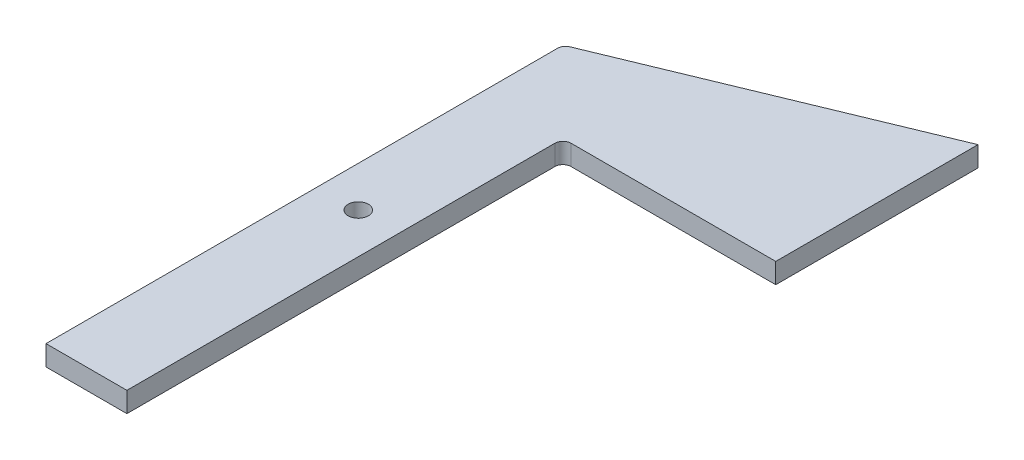
from build123d import *

# Parameters (mm, degrees)
BOSS_EXTRUDE1_DEPTH = 6.35
SKETCH2_R           = 3.175
CUT_EXTRUDE1_DEPTH  = 6.35
FILLET1_R           = 2.54


with BuildPart() as part:
    # Sketch1 → Boss-Extrude1 (new body)
    with BuildSketch(Plane(origin=(0, 0, 0), x_dir=(1, 0, 0), z_dir=(0, 1, 0))):
        Polygon((-50, 128.026), (42.202, 166.126), (42.202, 128.026), (42.202, 102.626), (-24.6, 102.626), (-24.6, -34.28), (-50, -34.28), align=None)
    extrude(amount=BOSS_EXTRUDE1_DEPTH)

    # Sketch2 → Cut-Extrude1 (cut)
    with BuildSketch(Plane(origin=(0, 6.35, 0), x_dir=(1, 0, 0), z_dir=(0, 1, 0))):
        with Locations((-37.3, 51.064)):
            Circle(SKETCH2_R)
    extrude(amount=-CUT_EXTRUDE1_DEPTH, mode=Mode.SUBTRACT)

    # Fillet1
    fillet1_edges = [part.edges().sort_by_distance(p)[0] for p in [
        (-24.6, 3.175, -102.626),
        (-50, 3.175, -128.026),
    ]]
    fillet(fillet1_edges, radius=FILLET1_R)


solid = part.part
